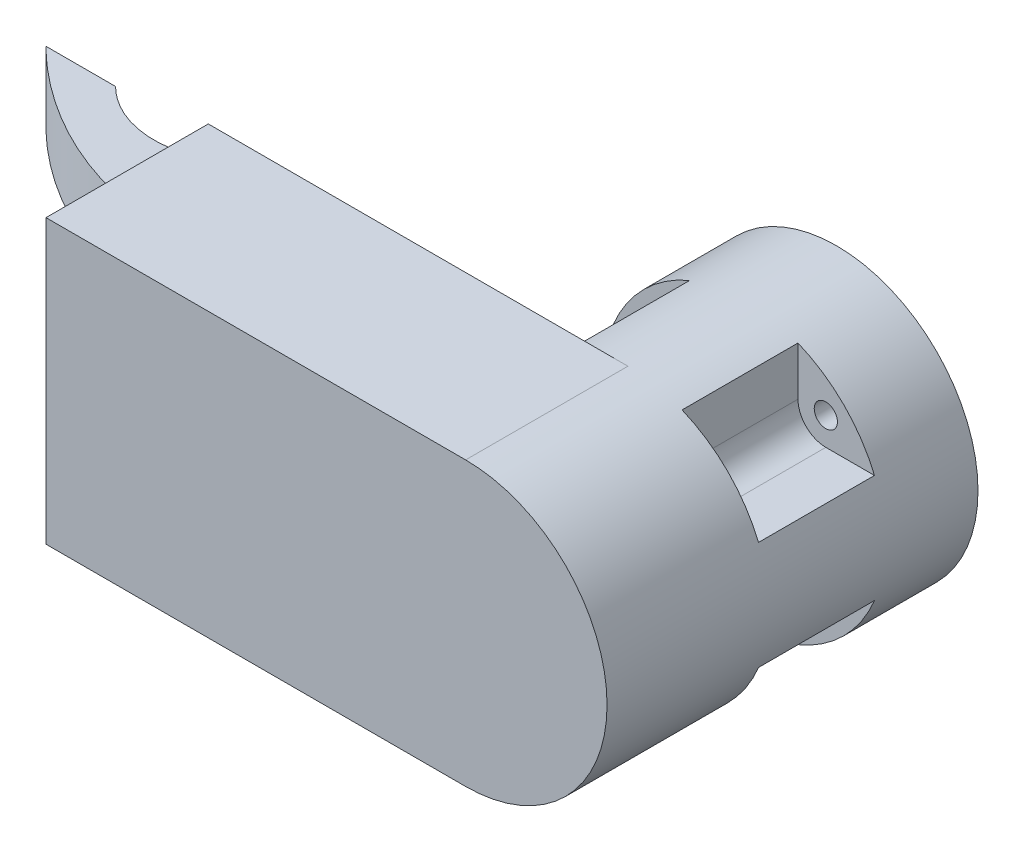
from build123d import *

# Parameters (mm, degrees)
SKETCH1_R                            = 30.5
BOSS_EXTRUDE1_DEPTH                  = 80
CUT_EXTRUDE1_REACH                   = 142.887
CUT_EXTRUDE1_START                   = -50
SKETCH2_R                            = 2.5
SKETCH7_W                            = 35
SKETCH7_H                            = 61
BOSS_EXTRUDE4_DEPTH                  = 60
BOSS_EXTRUDE4_DIRECTION_2_REACH      = 107.125
BOSS_EXTRUDE4_DIRECTION_2_END_RADIUS = 30.5
LOFT3_START                          = 12.5
LOFT3_DEPTH                          = 15
CUT_EXTRUDE2_START                   = -20
CUT_EXTRUDE2_DEPTH                   = 25
CIRPATTERN1_COUNT                    = 4


# Read off the part's stored shape, not the designer's step: Loft3
with BuildPart() as part:
    # Sketch1 → Boss-Extrude1 (new body)
    with BuildSketch(Plane.XY):
        Circle(SKETCH1_R)
    extrude(amount=BOSS_EXTRUDE1_DEPTH)

    # Sketch2 → Cut-Extrude1 (cut, up to next)
    with BuildSketch(Plane.XY.offset(80).offset(CUT_EXTRUDE1_START), mode=Mode.PRIVATE) as cut_extrude1_sk1:
        with Locations((17.68, -17.68)):
            Circle(SKETCH2_R)
    cut_extrude1_tool1 = extrude(cut_extrude1_sk1.sketch, amount=-CUT_EXTRUDE1_REACH, mode=Mode.PRIVATE) & part.part
    # Sketch2 → Cut-Extrude1 (cut, up to next)
    with BuildSketch(Plane.XY.offset(80).offset(CUT_EXTRUDE1_START), mode=Mode.PRIVATE) as cut_extrude1_sk2:
        with Locations((17.68, 17.68)):
            Circle(SKETCH2_R)
    cut_extrude1_tool2 = extrude(cut_extrude1_sk2.sketch, amount=-CUT_EXTRUDE1_REACH, mode=Mode.PRIVATE) & part.part
    # Sketch2 → Cut-Extrude1 (cut, up to next)
    with BuildSketch(Plane.XY.offset(80).offset(CUT_EXTRUDE1_START), mode=Mode.PRIVATE) as cut_extrude1_sk3:
        with Locations((-17.68, 17.68)):
            Circle(SKETCH2_R)
    cut_extrude1_tool3 = extrude(cut_extrude1_sk3.sketch, amount=-CUT_EXTRUDE1_REACH, mode=Mode.PRIVATE) & part.part
    # Sketch2 → Cut-Extrude1 (cut, up to next)
    with BuildSketch(Plane.XY.offset(80).offset(CUT_EXTRUDE1_START), mode=Mode.PRIVATE) as cut_extrude1_sk4:
        with Locations((-17.68, -17.68)):
            Circle(SKETCH2_R)
    cut_extrude1_tool4 = extrude(cut_extrude1_sk4.sketch, amount=-CUT_EXTRUDE1_REACH, mode=Mode.PRIVATE) & part.part
    add(cut_extrude1_tool1.solids().sort_by_distance((17.68, -17.68, 30))[0], mode=Mode.SUBTRACT)
    add(cut_extrude1_tool2.solids().sort_by_distance((17.68, 17.68, 30))[0], mode=Mode.SUBTRACT)
    add(cut_extrude1_tool3.solids().sort_by_distance((-17.68, 17.68, 30))[0], mode=Mode.SUBTRACT)
    add(cut_extrude1_tool4.solids().sort_by_distance((-17.68, -17.68, 30))[0], mode=Mode.SUBTRACT)

    # Sketch7 → Boss-Extrude4 (add)
    with BuildSketch(Plane.ZY.offset(30.5)):
        with Locations((62.5, 0)):
            Rectangle(SKETCH7_W, SKETCH7_H)
    extrude(amount=BOSS_EXTRUDE4_DEPTH)

    # Boss-Extrude4 direction 2: up to this cylinder (the profile starts outside it)
    boss_extrude4_direction_2_end = Plane(origin=(0, 0, 62.5), z_dir=(0, 0, -1)) * Cylinder(BOSS_EXTRUDE4_DIRECTION_2_END_RADIUS, 276.25, mode=Mode.PRIVATE)
    # Sketch7 → Boss-Extrude4 direction 2 (add, up to the surface)
    with BuildSketch(Plane.ZY.offset(30.5), mode=Mode.PRIVATE) as boss_extrude4_direction_2_sk1:
        with Locations((62.5, 0)):
            Rectangle(SKETCH7_W, SKETCH7_H)
    boss_extrude4_direction_2_tool1 = extrude(boss_extrude4_direction_2_sk1.sketch, amount=-BOSS_EXTRUDE4_DIRECTION_2_REACH, mode=Mode.PRIVATE) - boss_extrude4_direction_2_end
    add(boss_extrude4_direction_2_tool1.solids().sort_by_distance((-30.5, 0, 62.5))[0])
    add(boss_extrude4_direction_2_tool1.solids().sort_by_distance((-30.5, 0, 62.5))[1])

    # Loft3 outline → Loft3 (add)
    with BuildSketch(Plane(origin=(0, 0, 0), x_dir=(1, 0, 0), z_dir=(0, 1, 0)).offset(LOFT3_START)):
        with BuildLine():
            add(Edge.make_bspline(
                [(-90.5, -65), (-102.577141217, -62.16196551), (-115.272859166, -55.238036023), (-125.5, -45)],
                knots=[0, 0, 0, 0, 1, 1, 1, 1], degree=3))
            Line((-90.5, -65), (-90.5, -50))
            add(Edge.make_bspline(
                [(-90.5, -50), (-97.577141217, -52.16196551), (-105.272859166, -50.238036023), (-110.5, -45)],
                knots=[0, 0, 0, 0, 1, 1, 1, 1], degree=3))
            Line((-110.5, -45), (-125.5, -45))
        make_face()
    loft3 = extrude(amount=LOFT3_DEPTH)

    # Mirror1: Loft3 across plane
    add(loft3.mirror(Plane.ZX))

    # Sketch10 → Cut-Extrude2 (cut)
    with BuildSketch(Plane(origin=(0, 0, 0), x_dir=(-1, 0, 0), z_dir=(0, 0, -1)).offset(CUT_EXTRUDE2_START)):
        with BuildLine():
            Line((11.68, 17.68), (11.68, 28.174946318))
            ThreePointArc((11.68, 28.174946318), (21.566756826, 21.566756826), (28.174946318, 11.68))
            Line((28.174946318, 11.68), (17.68, 11.68))
            ThreePointArc((17.68, 11.68), (13.437359313, 13.437359313), (11.68, 17.68))
        make_face()
    cut_extrude2 = extrude(amount=-CUT_EXTRUDE2_DEPTH, mode=Mode.SUBTRACT)

    # CirPattern1: Cut-Extrude2 ×4 about axis
    cirpattern1_axis = Axis((0, 0, 0), (0, 0, 1))
    for i in range(1, CIRPATTERN1_COUNT):
        add(cut_extrude2.rotate(cirpattern1_axis, i * 360 / CIRPATTERN1_COUNT), mode=Mode.SUBTRACT)


solid = part.part
